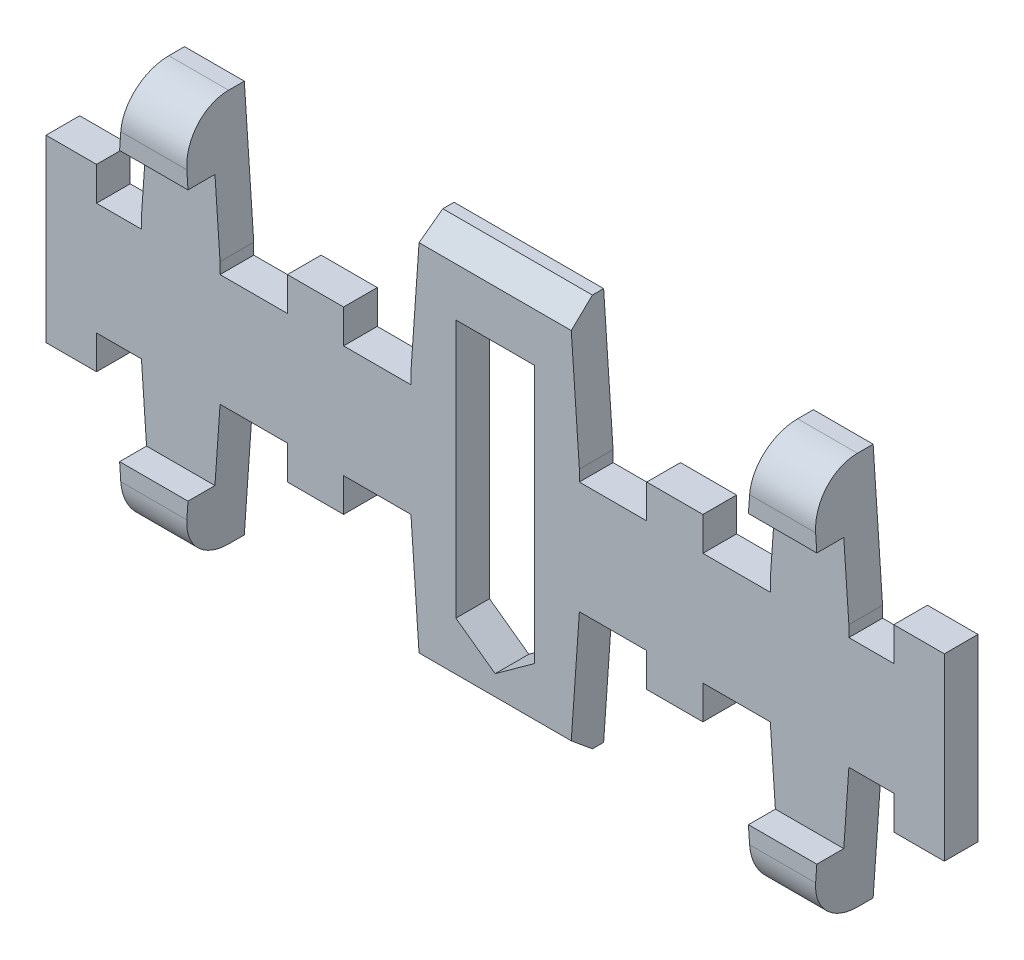
from build123d import *
from OCP.BRepFilletAPI import BRepFilletAPI_MakeChamfer

# Parameters (mm, degrees)
ESBO_O10_W               = 40
ESBO_O10_H               = 17.5
RESSALTO_EXTRUS_O6_DEPTH = 1.5
CORTE_EXTRUS_O2_DEPTH    = 2.5
ESBO_O12_W               = 3.5
ESBO_O12_H               = 2.75
RESSALTO_EXTRUS_O7_DEPTH = 1.2
ESBO_O13_W               = 3
ESBO_O13_H               = 1.5
ESBO_O13_W_2             = 2
CORTE_EXTRUS_O3_DEPTH    = 8
CORTE_EXTRUS_O4_DEPTH    = 20
CHANFRO5_SIZE            = 6
CHANFRO5_SIZE_2          = 0.419560872
CHANFRO6_SIZE            = 1
CHANFRO6_SIZE2           = 0.839099631
FILETE1_R                = 2


with BuildPart() as part:
    # Esboço10 → Ressalto-extrusão6 (new body)
    with BuildSketch(Plane.XY):
        Rectangle(ESBO_O10_W, ESBO_O10_H)
    extrude(amount=RESSALTO_EXTRUS_O6_DEPTH)

    # Esboço11 → Corte-extrusão2 (cut)
    with BuildSketch(Plane.XY.offset(1.5)):
        Polygon((-20, 3.75), (-15.75, 3.75), (-15.75, 8.75), (-12.25, 8.75), (-12.25, 3.75), (-3.75, 3.75), (-3.75, 9.75), (3.75, 9.75), (3.75, 3.75), (12.25, 3.75), (12.25, 8.75), (15.75, 8.75), (15.75, 3.75), (20, 3.75), (20, 11.902365005), (-20, 11.902365005), align=None)
        Polygon((-20, -4.25), (-15.75, -4.25), (-15.75, -8.75), (-12.25, -8.75), (-12.25, -4.25), (-3.75, -4.25), (-3.75, -10.25), (3.75, -9.74672567), (3.75, -4.25), (12.25, -4.25), (12.25, -8.75), (15.75, -8.75), (15.75, -4.25), (20, -4.25), (20, -11.31917021), (-20, -11.31917021), align=None)
    extrude(amount=-CORTE_EXTRUS_O2_DEPTH, mode=Mode.SUBTRACT)

    # Esboço12 → Ressalto-extrusão7 (add)
    with BuildSketch(Plane.XY.offset(1.5)):
        with Locations((-14, 7.375)):
            Rectangle(ESBO_O12_W, ESBO_O12_H)
        with Locations((-14, -7.375)):
            Rectangle(ESBO_O12_W, ESBO_O12_H)
        with Locations((14, -7.375)):
            Rectangle(ESBO_O12_W, ESBO_O12_H)
        with Locations((14, 7.375)):
            Rectangle(ESBO_O12_W, ESBO_O12_H)
    extrude(amount=RESSALTO_EXTRUS_O7_DEPTH)

    # Esboço13 → Corte-extrusão3 (cut)
    with BuildSketch(Plane.XY.offset(1.5)):
        with Locations((-10.75, 3)):
            Rectangle(ESBO_O13_W, ESBO_O13_H)
        with Locations((-5.25, 3)):
            Rectangle(ESBO_O13_W, ESBO_O13_H)
        with Locations((5.25, 3)):
            Rectangle(ESBO_O13_W, ESBO_O13_H)
        with Locations((10.75, 3)):
            Rectangle(ESBO_O13_W, ESBO_O13_H)
        with Locations((10.75, -3.5)):
            Rectangle(ESBO_O13_W, ESBO_O13_H)
        with Locations((5.25, -3.5)):
            Rectangle(ESBO_O13_W, ESBO_O13_H)
        with Locations((-5.25, -3.5)):
            Rectangle(ESBO_O13_W, ESBO_O13_H)
        with Locations((-10.75, -3.5)):
            Rectangle(ESBO_O13_W, ESBO_O13_H)
        with Locations((-16.75, -3.5)):
            Rectangle(ESBO_O13_W_2, ESBO_O13_H)
        with Locations((-16.75, 3)):
            Rectangle(ESBO_O13_W_2, ESBO_O13_H)
        with Locations((16.75, 3)):
            Rectangle(ESBO_O13_W_2, ESBO_O13_H)
        with Locations((16.75, -3.5)):
            Rectangle(ESBO_O13_W_2, ESBO_O13_H)
    extrude(amount=-CORTE_EXTRUS_O3_DEPTH, mode=Mode.SUBTRACT)

    # Esboço15 → Corte-extrusão4 (cut)
    with BuildSketch(Plane.XY.offset(1.5)):
        Polygon((-1.75, 5.75), (1.75, 5.75), (1.75, -5.75), (0, -7.015048633), (-1.75, -5.75), align=None)
    extrude(amount=-CORTE_EXTRUS_O4_DEPTH, mode=Mode.SUBTRACT)

    # Chanfro5
    chanfro5_edges_1 = [part.edges().sort_by_distance(p)[0] for p in [
        (-15.75, -8.75, 1.35),
    ]]
    chanfro5_side_1 = [part.faces().sort_by_distance(p)[0] for p in [
        (-15.75, -8.741608783, 1.35),
    ]]
    chanfro5_edges_2 = [part.edges().sort_by_distance(p)[0] for p in [
        (-3.75, -8.75, 0.75),
    ]]
    chanfro5_side_2 = [part.faces().sort_by_distance(p)[0] for p in [
        (-3.75, -8.741608783, 0.75),
    ]]
    chanfro5_edges_3 = [part.edges().sort_by_distance(p)[0] for p in [
        (12.25, -8.75, 1.35),
    ]]
    chanfro5_side_3 = [part.faces().sort_by_distance(p)[0] for p in [
        (12.25, -8.741608783, 1.35),
    ]]
    chanfro5_edges_4 = [part.edges().sort_by_distance(p)[0] for p in [
        (15.75, 8.75, 1.35),
    ]]
    chanfro5_side_4 = [part.faces().sort_by_distance(p)[0] for p in [
        (15.741608783, 8.75, 1.35),
    ]]
    chanfro5_edges_5 = [part.edges().sort_by_distance(p)[0] for p in [
        (3.75, 8.75, 0.75),
    ]]
    chanfro5_side_5 = [part.faces().sort_by_distance(p)[0] for p in [
        (3.741608783, 8.75, 0.75),
    ]]
    chanfro5_edges_6 = [part.edges().sort_by_distance(p)[0] for p in [
        (-12.25, 8.75, 1.35),
    ]]
    chanfro5_side_6 = [part.faces().sort_by_distance(p)[0] for p in [
        (-12.258391217, 8.75, 1.35),
    ]]
    chanfro5_edges_7 = [part.edges().sort_by_distance(p)[0] for p in [
        (-12.25, -8.75, 1.35),
    ]]
    chanfro5_side_7 = [part.faces().sort_by_distance(p)[0] for p in [
        (-12.258391217, -8.75, 1.35),
    ]]
    chanfro5_edges_8 = [part.edges().sort_by_distance(p)[0] for p in [
        (3.75, -8.75, 0.75),
    ]]
    chanfro5_side_8 = [part.faces().sort_by_distance(p)[0] for p in [
        (3.741608783, -8.75, 0.75),
    ]]
    chanfro5_edges_9 = [part.edges().sort_by_distance(p)[0] for p in [
        (15.75, -8.75, 1.35),
    ]]
    chanfro5_side_9 = [part.faces().sort_by_distance(p)[0] for p in [
        (15.741608783, -8.75, 1.35),
    ]]
    chanfro5_edges_10 = [part.edges().sort_by_distance(p)[0] for p in [
        (12.25, 8.75, 1.35),
    ]]
    chanfro5_side_10 = [part.faces().sort_by_distance(p)[0] for p in [
        (12.25, 8.741608783, 1.35),
    ]]
    chanfro5_edges_11 = [part.edges().sort_by_distance(p)[0] for p in [
        (-3.75, 8.75, 0.75),
    ]]
    chanfro5_side_11 = [part.faces().sort_by_distance(p)[0] for p in [
        (-3.75, 8.741608783, 0.75),
    ]]
    chanfro5_edges_12 = [part.edges().sort_by_distance(p)[0] for p in [
        (-15.75, 8.75, 1.35),
    ]]
    chanfro5_side_12 = [part.faces().sort_by_distance(p)[0] for p in [
        (-15.741608783, 8.75, 1.35),
    ]]
    chanfro5 = BRepFilletAPI_MakeChamfer(part.part.solid().wrapped)
    for e in chanfro5_edges_1:
        chanfro5.Add(CHANFRO5_SIZE - 0.0001, CHANFRO5_SIZE_2 - 0.0001, e.wrapped, chanfro5_side_1[0].wrapped)
    for e in chanfro5_edges_2:
        chanfro5.Add(CHANFRO5_SIZE - 0.0001, CHANFRO5_SIZE_2 - 0.0001, e.wrapped, chanfro5_side_2[0].wrapped)
    for e in chanfro5_edges_3:
        chanfro5.Add(CHANFRO5_SIZE - 0.0001, CHANFRO5_SIZE_2 - 0.0001, e.wrapped, chanfro5_side_3[0].wrapped)
    for e in chanfro5_edges_4:
        chanfro5.Add(CHANFRO5_SIZE_2 - 0.0001, CHANFRO5_SIZE - 0.0001, e.wrapped, chanfro5_side_4[0].wrapped)
    for e in chanfro5_edges_5:
        chanfro5.Add(CHANFRO5_SIZE_2 - 0.0001, CHANFRO5_SIZE - 0.0001, e.wrapped, chanfro5_side_5[0].wrapped)
    for e in chanfro5_edges_6:
        chanfro5.Add(CHANFRO5_SIZE_2 - 0.0001, CHANFRO5_SIZE - 0.0001, e.wrapped, chanfro5_side_6[0].wrapped)
    for e in chanfro5_edges_7:
        chanfro5.Add(CHANFRO5_SIZE_2 - 0.0001, CHANFRO5_SIZE - 0.0001, e.wrapped, chanfro5_side_7[0].wrapped)
    for e in chanfro5_edges_8:
        chanfro5.Add(CHANFRO5_SIZE_2 - 0.0001, CHANFRO5_SIZE - 0.0001, e.wrapped, chanfro5_side_8[0].wrapped)
    for e in chanfro5_edges_9:
        chanfro5.Add(CHANFRO5_SIZE_2 - 0.0001, CHANFRO5_SIZE - 0.0001, e.wrapped, chanfro5_side_9[0].wrapped)
    for e in chanfro5_edges_10:
        chanfro5.Add(CHANFRO5_SIZE - 0.0001, CHANFRO5_SIZE_2 - 0.0001, e.wrapped, chanfro5_side_10[0].wrapped)
    for e in chanfro5_edges_11:
        chanfro5.Add(CHANFRO5_SIZE - 0.0001, CHANFRO5_SIZE_2 - 0.0001, e.wrapped, chanfro5_side_11[0].wrapped)
    for e in chanfro5_edges_12:
        chanfro5.Add(CHANFRO5_SIZE_2 - 0.0001, CHANFRO5_SIZE - 0.0001, e.wrapped, chanfro5_side_12[0].wrapped)
    add(Compound.cast(chanfro5.Shape()), mode=Mode.REPLACE)  # a hair under: the kernel refuses the full size

    # Chanfro6: one chamfer whose edges measure the first distance from different faces: ONE call of the kernel's chamfer builder (chamfer() names one face for all edges)
    chanfro6_edges_1 = [part.edges().sort_by_distance(p)[0] for p in [
        (0, -8.75, 1.5),
    ]]
    chanfro6_side_1 = [part.faces().sort_by_distance(p)[0] for p in [
        (0, -8.75, 0.75),
    ]]
    chanfro6_edges_2 = [part.edges().sort_by_distance(p)[0] for p in [
        (0, 8.75, 1.5),
    ]]
    chanfro6_side_2 = [part.faces().sort_by_distance(p)[0] for p in [
        (0, 8.75, 0.75),
    ]]
    chanfro6 = BRepFilletAPI_MakeChamfer(part.part.solid().wrapped)
    for e in chanfro6_edges_1:
        chanfro6.Add(CHANFRO6_SIZE, CHANFRO6_SIZE2, e.wrapped, chanfro6_side_1[0].wrapped)  # the first distance lies on this face
    for e in chanfro6_edges_2:
        chanfro6.Add(CHANFRO6_SIZE, CHANFRO6_SIZE2, e.wrapped, chanfro6_side_2[0].wrapped)  # the first distance lies on this face
    add(Compound.cast(chanfro6.Shape()), mode=Mode.REPLACE)

    # Filete1
    filete1_edges = [part.edges().sort_by_distance(p)[0] for p in [
        (-14, -8.75, 2.7),
        (14, -8.75, 2.7),
        (14, 8.75, 2.7),
        (-14, 8.75, 2.7),
    ]]
    fillet(filete1_edges, radius=FILETE1_R)


solid = part.part
